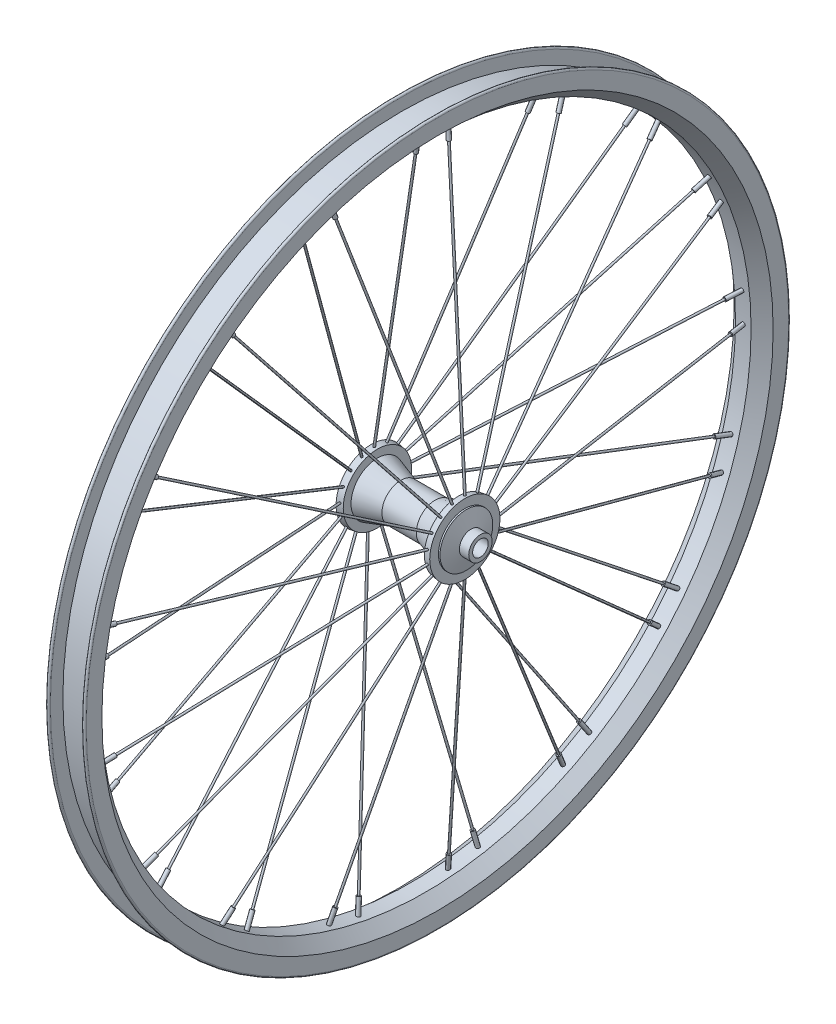
from build123d import *

# Parameters (mm, degrees)
REVOLVE2_START         = 22.591222243
REVOLVE2_OUTLINE_R     = 0.79375
REVOLVE2_DEPTH         = 239.354391083
REVOLVE2_START_2       = 249.24561376
REVOLVE2_2_OUTLINE_R   = 1.5875
REVOLVE2_2_OUTLINE_R_2 = 0.79375
REVOLVE2_2_DEPTH       = 12.699999566
CIRPATTERN1_COUNT      = 17


# Read off the part's stored shape, not the designer's step: Revolve2
with BuildPart() as part:
    # Sketch1 → Revolve1 (revolve)
    with BuildSketch(Plane(origin=(0, 0, 0), x_dir=(1, 0, 0), z_dir=(0, 1, 0)), mode=Mode.PRIVATE) as revolve1_sk:
        Polygon((-50.8, 6.35), (50.8, 6.35), (50.8, 9.525), (43.18, 9.525), (39.37, 21.461034408), (38.1, 21.461034408), (38.1, 28.575), (33.02, 27.811034408), (33.02, 21.461034408), (13.97, 15.380245971), (-13.97, 15.380245971), (-33.02, 21.461034408), (-33.02, 27.811034408), (-38.1, 28.575), (-38.1, 21.461034408), (-39.37, 21.461034408), (-43.18, 9.525), (-50.8, 9.525), align=None)
        with BuildLine():
            Line((-6.35, 264.649739587), (6.35, 264.649739587))
            Line((6.35, 264.649739587), (15.875, 273.05))
            Line((15.875, 273.05), (15.875, 285.75))
            ThreePointArc((15.875, 285.75), (14.605, 287.02), (13.335, 285.75))
            Line((13.335, 285.75), (13.335, 275.59))
            Line((13.335, 275.59), (-13.335, 275.59))
            Line((-13.335, 275.59), (-13.335, 285.75))
            ThreePointArc((-13.335, 285.75), (-14.605, 287.02), (-15.875, 285.75))
            Line((-15.875, 285.75), (-15.875, 273.05))
            Line((-15.875, 273.05), (-6.35, 264.649739587))
        make_face()
    revolve(revolve1_sk.sketch.rotate(Axis((-60.772398323, 0, 0), (1, 0, 0)), 180), axis=Axis((-60.772398323, 0, 0), (1, 0, 0)))

    # Revolve2 outline → Revolve2 (add)
    with BuildSketch(Plane(origin=(0, 0, 0), x_dir=(0.9888801512534822, -0.14871464775498802, 0), z_dir=(0.14871464775498802, 0.9888801512534823, 0)).offset(REVOLVE2_START)):
        with Locations((-39.357292801, 0)):
            Circle(REVOLVE2_OUTLINE_R)
    revolve2 = extrude(amount=REVOLVE2_DEPTH)

    # Revolve2 2 outline → Revolve2 2 (add)
    with BuildSketch(Plane(origin=(0, 0, 0), x_dir=(0.9888801512534822, -0.14871464775498802, 0), z_dir=(0.14871464775498802, 0.9888801512534823, 0)).offset(REVOLVE2_START_2)):
        with Locations((-39.357292801, 0)):
            Circle(REVOLVE2_2_OUTLINE_R)
        with Locations((-39.357292801, 0)):
            Circle(REVOLVE2_2_OUTLINE_R_2, mode=Mode.SUBTRACT)
    revolve2_2 = extrude(amount=REVOLVE2_2_DEPTH)

    # Sketch3 → Revolve3 (revolve)
    with BuildSketch(Plane(origin=(0, 0, 0), x_dir=(1, 0, 0), z_dir=(0, 1, 0))):
        Polygon((35.56, 28.193017204), (0, 264.649739587), (-0.802675632, 264.649739587), (-1.605351263, 264.649739587), (0.283324763, 252.090961666), (1.068248383, 252.209003918), (34.77507638, 28.074974952), align=None)
    revolve3 = revolve(axis=Axis((0, 0, -264.649739587), (0.14871464775498777, 0, 0.9888801512534823)))

    # CirPattern1: Revolve2, Revolve2 2, Revolve3 ×17 about axis
    cirpattern1_axis = Axis((0, 0, 0), (1, 0, 0))
    add([revolve2.rotate(cirpattern1_axis, i * 360 / CIRPATTERN1_COUNT) for i in range(1, CIRPATTERN1_COUNT)])
    add([revolve2_2.rotate(cirpattern1_axis, i * 360 / CIRPATTERN1_COUNT) for i in range(1, CIRPATTERN1_COUNT)])
    add([revolve3.rotate(cirpattern1_axis, i * 360 / CIRPATTERN1_COUNT) for i in range(1, CIRPATTERN1_COUNT)])


solid = part.part
